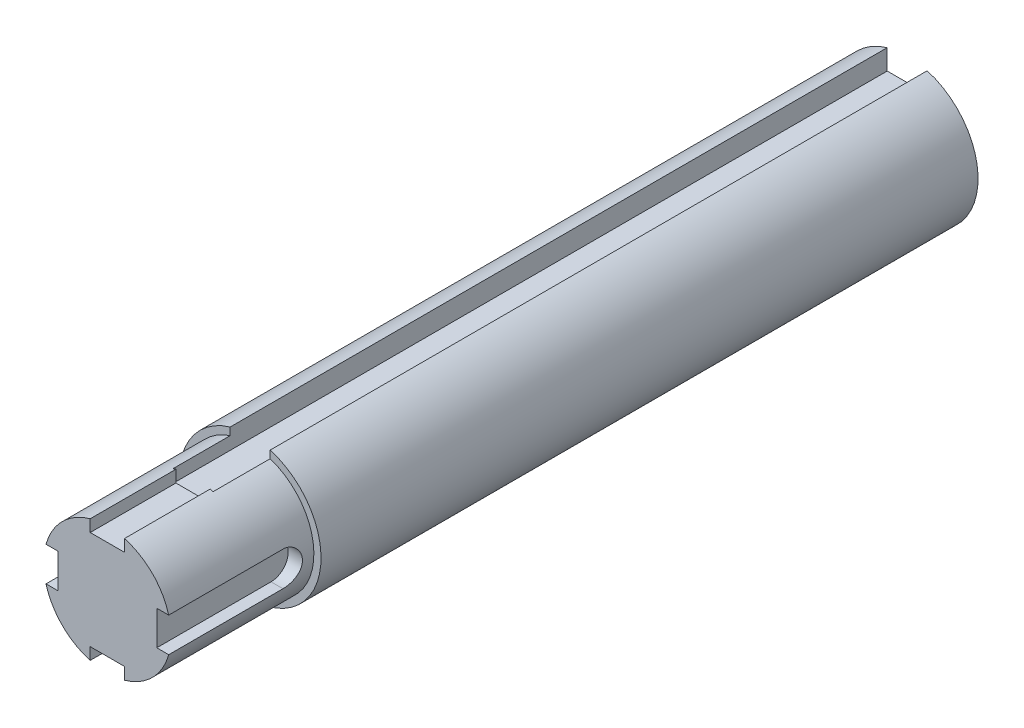
from build123d import *

# Parameters (mm, degrees)
SKETCH1_R           = 24.8
BOSS_EXTRUDE1_DEPTH = 280
SKETCH2_W           = 14
SKETCH2_H           = 11.417769158
CUT_EXTRUDE1_DEPTH  = 250
SKETCH3_R           = 7
CUT_EXTRUDE2_DEPTH  = 30
THREAD1_PITCH       = 1.75
SKETCH4_OUTSIDE_W   = 109.33
SKETCH4_OUTSIDE_H   = 109.33
SKETCH4_OUTSIDE_R   = 22.3
CUT_EXTRUDE3_DEPTH  = 50
CUT_EXTRUDE4_DEPTH  = 5
CIRPATTERN1_COUNT   = 4


with BuildPart() as part:
    # Sketch1 → Boss-Extrude1 (new body)
    with BuildSketch(Plane.XY):
        Circle(SKETCH1_R)
    extrude(amount=BOSS_EXTRUDE1_DEPTH)

    # Sketch2 → Cut-Extrude1 (cut)
    with BuildSketch(Plane(origin=(0, 0, 0), x_dir=(-1, 0, 0), z_dir=(0, 0, -1))):
        with Locations((0, 22.408884579)):
            Rectangle(SKETCH2_W, SKETCH2_H)
    extrude(amount=-CUT_EXTRUDE1_DEPTH, mode=Mode.SUBTRACT)

    # Sketch3 → Cut-Extrude2 (cut)
    with BuildSketch(Plane(origin=(0, 0, 0), x_dir=(-1, 0, 0), z_dir=(0, 0, -1))):
        Circle(SKETCH3_R)
    extrude(amount=-CUT_EXTRUDE2_DEPTH, mode=Mode.SUBTRACT)

    # Thread1: the profile of Thread Profile1 profile screwed along a right-hand helix of 17.142857 turns, 10 arcs to a turn; built about Z, then put on its axis
    thread1_z = Axis((0, 0, 0), (0, 0, 1))
    thread1_corners = [(7.0003, 0, -0.000173205), (7.0003, 0, 1.5314232), (6.052784719, 0, 0.984374998), (6.052784719, 0, 0.546874998)]
    with BuildLine(mode=Mode.PRIVATE) as thread1_profile:
        Line(thread1_corners[0], thread1_corners[1])
        Line(thread1_corners[1], thread1_corners[2])
        Line(thread1_corners[2], thread1_corners[3])
        Line(thread1_corners[3], thread1_corners[0])
    thread1_cap = Face(thread1_profile.wire())
    thread1_turn_angles = [0, 18, 36, 54, 72, 90, 108, 126, 144, 162, 180, 198, 216, 234, 252, 270, 288, 306, 324, 342, 360]
    thread1_turn_weights = [1, 0.9510565162951535, 1, 0.9510565162951535, 1, 0.9510565162951535, 1, 0.9510565162951535, 1, 0.9510565162951535, 1, 0.9510565162951535, 1, 0.9510565162951535, 1, 0.9510565162951535, 1, 0.9510565162951535, 1, 0.9510565162951535, 1]
    thread1_turn_rails = [Edge.make_bspline([Vector(p[0], p[1], 0).rotate(thread1_z, thread1_turn_angles[k]) / thread1_turn_weights[k] + Vector(0, 0, p[2] + THREAD1_PITCH * thread1_turn_angles[k] / 360) for k in range(21)], [0, 0, 0, 1, 1, 2, 2, 3, 3, 4, 4, 5, 5, 6, 6, 7, 7, 8, 8, 9, 9, 10, 10, 10], 2, thread1_turn_weights) for p in thread1_corners]
    thread1_turn_sides = [Face.make_surface_from_curves(thread1_turn_rails[p[0]], thread1_turn_rails[p[1]]) for p in [(0, 1), (1, 2), (2, 3), (3, 0)]]
    thread1_last_angles = [6120, 6138, 6156, 6163.714285714, 6171.428571429]
    thread1_last_weights = [1, 0.9510565162951535, 1, 0.9909497617679346, 1]
    thread1_last_rails = [Edge.make_bspline([Vector(p[0], p[1], 0).rotate(thread1_z, thread1_last_angles[k]) / thread1_last_weights[k] + Vector(0, 0, p[2] + THREAD1_PITCH * thread1_last_angles[k] / 360) for k in range(5)], [0, 0, 0, 1, 1, 2, 2, 2], 2, thread1_last_weights) for p in thread1_corners]
    thread1_last_sides = [Face.make_surface_from_curves(thread1_last_rails[p[0]], thread1_last_rails[p[1]]) for p in [(0, 1), (1, 2), (2, 3), (3, 0)]]
    thread1 = Plane(origin=(0, 0, 0), x_dir=(1, 0, 0), z_dir=(0, 0, 1)) * Solid(Shell([*[p.moved(Location((0, 0, THREAD1_PITCH * i))) for i in range(17) for p in thread1_turn_sides], *thread1_last_sides, thread1_cap, thread1_cap.rotate(thread1_z, 6171.428571429).moved(Location((0, 0, THREAD1_PITCH * 6171.428571429 / 360)))]))
    add(thread1)

    # Sketch4 outside → Cut-Extrude3 (cut)
    with BuildSketch(Plane.XY.offset(280)):
        Rectangle(SKETCH4_OUTSIDE_W, SKETCH4_OUTSIDE_H)
        Circle(SKETCH4_OUTSIDE_R, mode=Mode.SUBTRACT)
    extrude(amount=-CUT_EXTRUDE3_DEPTH, mode=Mode.SUBTRACT)

    # Sketch5 → Cut-Extrude4 (cut)
    with BuildSketch(Plane(origin=(0, -22.3, 0), x_dir=(0, 0, 1), z_dir=(0, -1, 0))):
        with BuildLine():
            Line((280, -6), (240, -6))
            ThreePointArc((240, -6), (234, 0), (240, 6))
            Line((240, 6), (280, 6))
            ThreePointArc((280, 6), (286, 0), (280, -6))
        make_face()
    cut_extrude4 = extrude(amount=-CUT_EXTRUDE4_DEPTH, mode=Mode.SUBTRACT)

    # CirPattern1: Cut-Extrude4 ×4 about axis
    cirpattern1_axis = Axis((0, 0, 0), (0, 0, 1))
    for i in range(1, CIRPATTERN1_COUNT):
        add(cut_extrude4.rotate(cirpattern1_axis, i * 360 / CIRPATTERN1_COUNT), mode=Mode.SUBTRACT)


solid = part.part
